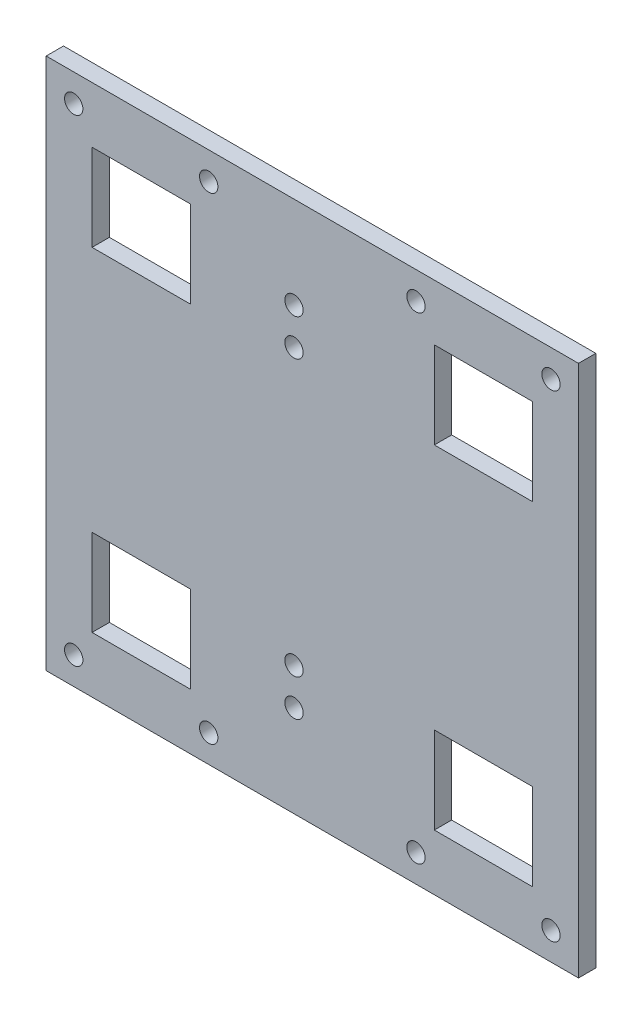
from build123d import *

# Parameters (mm, degrees)
SKETCH1_W           = 184.15
SKETCH1_H           = 184.15
SKETCH1_R           = 3.175
SKETCH1_W_2         = 34
SKETCH1_H_2         = 30
BOSS_EXTRUDE1_DEPTH = 5.9944


with BuildPart() as part:
    # Sketch1 → Boss-Extrude1 (new body)
    with BuildSketch(Plane.XY):
        with Locations((92.075, 92.075)):
            Rectangle(SKETCH1_W, SKETCH1_H)
        with Locations((9.525, 174.625)):
            Circle(SKETCH1_R, mode=Mode.SUBTRACT)
        with Locations((56.22544, 174.625)):
            Circle(SKETCH1_R, mode=Mode.SUBTRACT)
        with Locations((127.92456, 174.625)):
            Circle(SKETCH1_R, mode=Mode.SUBTRACT)
        with Locations((174.625, 174.625)):
            Circle(SKETCH1_R, mode=Mode.SUBTRACT)
        with Locations((85.725, 152.4)):
            Circle(SKETCH1_R, mode=Mode.SUBTRACT)
        with Locations((85.725, 139.7)):
            Circle(SKETCH1_R, mode=Mode.SUBTRACT)
        with Locations((9.525, 9.525)):
            Circle(SKETCH1_R, mode=Mode.SUBTRACT)
        with Locations((85.725, 44.45)):
            Circle(SKETCH1_R, mode=Mode.SUBTRACT)
        with Locations((56.22544, 9.525)):
            Circle(SKETCH1_R, mode=Mode.SUBTRACT)
        with Locations((85.725, 31.75)):
            Circle(SKETCH1_R, mode=Mode.SUBTRACT)
        with Locations((127.92456, 9.525)):
            Circle(SKETCH1_R, mode=Mode.SUBTRACT)
        with Locations((174.61738, 9.525)):
            Circle(SKETCH1_R, mode=Mode.SUBTRACT)
        with Locations((32.87522, 149.76218)):
            Rectangle(SKETCH1_W_2, SKETCH1_H_2, mode=Mode.SUBTRACT)
        with Locations((32.87522, 34.38782)):
            Rectangle(SKETCH1_W_2, SKETCH1_H_2, mode=Mode.SUBTRACT)
        with Locations((151.27478, 149.76218)):
            Rectangle(SKETCH1_W_2, SKETCH1_H_2, mode=Mode.SUBTRACT)
        with Locations((151.27478, 34.38782)):
            Rectangle(SKETCH1_W_2, SKETCH1_H_2, mode=Mode.SUBTRACT)
    extrude(amount=BOSS_EXTRUDE1_DEPTH)


solid = part.part
